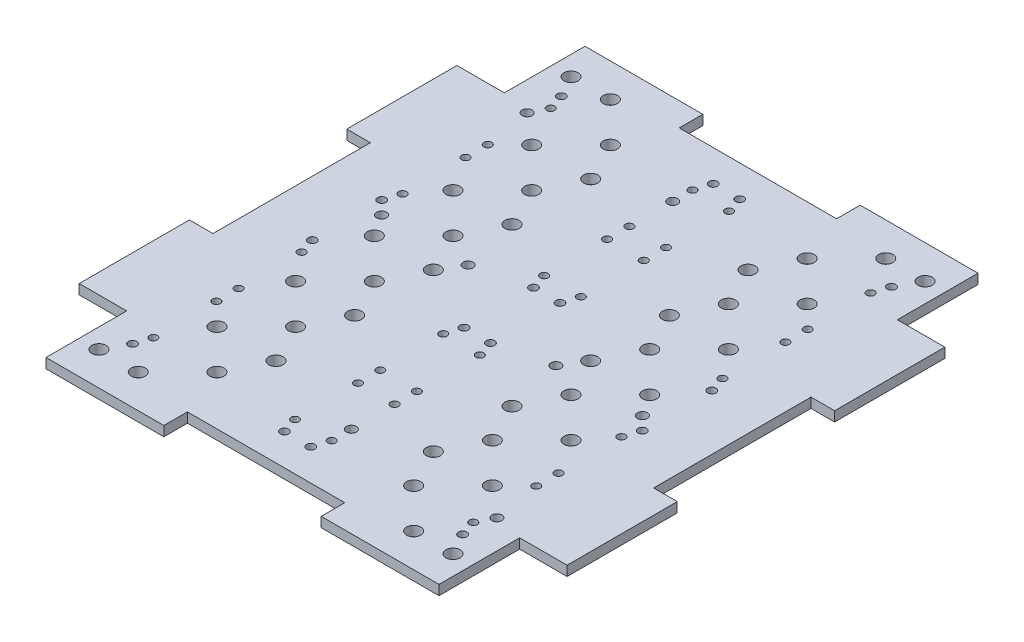
from build123d import *

# Parameters (mm, degrees)
SKETCH1_R                 = 2.286
BOSS_EXTRUDE1_DEPTH       = 3.175
SKETCH2_R                 = 1.35
RASPBERRY_PI_HOLES_DEPTH  = 118.380570155
SKETCH3_R                 = 1.27
FEATHER_BOARD_HOLES_DEPTH = 118.380570155
SKETCH4_R                 = 1.6
ARDUINO_UNO_1_DEPTH       = 118.380570155
SKETCH5_R                 = 1.6
ARDUINO_UNO_2_DEPTH       = 118.380570155
SKETCH6_R                 = 2.286
CUSTOM_PCB_3_INCH_DEPTH   = 118.380570155
SKETCH7_R                 = 2.286
CUSTOM_PCB_2_5_INCH_DEPTH = 118.380570155
SKETCH8_R                 = 2.286
CUSTOM_PCB_2_INCH_DEPTH   = 118.380570155


with BuildPart() as part:
    # Sketch1 → Boss-Extrude1 (new body)
    with BuildSketch(Plane(origin=(0, 0, 0), x_dir=(1, 0, 0), z_dir=(0, 1, 0))):
        Polygon((-25.4, 86.995), (-63.43142, 86.995), (-63.43142, 60.96), (-78.74, 60.96), (-78.74, 25.4), (-71.12, 25.4), (-71.12, -25.4), (-78.74, -25.4), (-78.74, -60.96), (-63.43142, -60.96), (-63.43142, -86.995), (-25.4, -86.995), (-25.4, -79.375), (25.4, -79.375), (25.4, -86.995), (63.43142, -86.995), (63.43142, -60.96), (78.74, -60.96), (78.74, -25.4), (71.12, -25.4), (71.12, 25.4), (78.74, 25.4), (78.74, 60.96), (63.43142, 60.96), (63.43142, 86.995), (25.4, 86.995), (25.4, 79.375), (-25.4, 79.375), align=None)
        with Locations((-57.15, 76.2)):
            Circle(SKETCH1_R, mode=Mode.SUBTRACT)
        with Locations((57.15, 76.2)):
            Circle(SKETCH1_R, mode=Mode.SUBTRACT)
        with Locations((57.15, -76.2)):
            Circle(SKETCH1_R, mode=Mode.SUBTRACT)
        with Locations((-57.15, -76.2)):
            Circle(SKETCH1_R, mode=Mode.SUBTRACT)
    extrude(amount=BOSS_EXTRUDE1_DEPTH)

    # Sketch2 → Raspberry Pi Holes (cut, through all)
    with BuildSketch(Plane(origin=(0, 3.175, 0), x_dir=(1, 0, 0), z_dir=(0, 1, 0))):
        with Locations((-53.27142, -69.215)):
            Circle(SKETCH2_R)
        with Locations((-4.27142, -69.215)):
            Circle(SKETCH2_R)
        with Locations((-4.27142, -11.215)):
            Circle(SKETCH2_R)
        with Locations((-53.27142, -11.215)):
            Circle(SKETCH2_R)
        with Locations((53.27142, -11.215)):
            Circle(SKETCH2_R)
        with Locations((4.27142, -11.215)):
            Circle(SKETCH2_R)
        with Locations((4.27142, -69.215)):
            Circle(SKETCH2_R)
        with Locations((53.27142, -69.215)):
            Circle(SKETCH2_R)
        with Locations((53.27142, 11.215)):
            Circle(SKETCH2_R)
        with Locations((53.27142, 69.215)):
            Circle(SKETCH2_R)
        with Locations((4.27142, 69.215)):
            Circle(SKETCH2_R)
        with Locations((4.27142, 11.215)):
            Circle(SKETCH2_R)
        with Locations((-4.27142, 11.215)):
            Circle(SKETCH2_R)
        with Locations((-4.27142, 69.215)):
            Circle(SKETCH2_R)
        with Locations((-53.27142, 11.215)):
            Circle(SKETCH2_R)
        with Locations((-53.27142, 69.215)):
            Circle(SKETCH2_R)
    extrude(amount=-RASPBERRY_PI_HOLES_DEPTH, mode=Mode.SUBTRACT)

    # Sketch3 → Feather Board Holes (cut, through all)
    with BuildSketch(Plane(origin=(0, 3.175, 0), x_dir=(1, 0, 0), z_dir=(0, 1, 0))):
        with Locations((-51.63142, -64.135)):
            Circle(SKETCH3_R)
        with Locations((-5.91142, -64.135)):
            Circle(SKETCH3_R)
        with Locations((-5.91142, -43.815)):
            Circle(SKETCH3_R)
        with Locations((-51.63142, -43.815)):
            Circle(SKETCH3_R)
        with Locations((-51.63142, -16.295)):
            Circle(SKETCH3_R)
        with Locations((-51.63142, -36.615)):
            Circle(SKETCH3_R)
        with Locations((-5.91142, -36.615)):
            Circle(SKETCH3_R)
        with Locations((-5.91142, -16.295)):
            Circle(SKETCH3_R)
        with Locations((5.91142, -16.295)):
            Circle(SKETCH3_R)
        with Locations((5.91142, -36.615)):
            Circle(SKETCH3_R)
        with Locations((51.63142, -36.615)):
            Circle(SKETCH3_R)
        with Locations((51.63142, -16.295)):
            Circle(SKETCH3_R)
        with Locations((51.63142, -43.815)):
            Circle(SKETCH3_R)
        with Locations((5.91142, -43.815)):
            Circle(SKETCH3_R)
        with Locations((5.91142, -64.135)):
            Circle(SKETCH3_R)
        with Locations((51.63142, -64.135)):
            Circle(SKETCH3_R)
        with Locations((51.63142, 64.135)):
            Circle(SKETCH3_R)
        with Locations((5.91142, 64.135)):
            Circle(SKETCH3_R)
        with Locations((5.91142, 43.815)):
            Circle(SKETCH3_R)
        with Locations((51.63142, 43.815)):
            Circle(SKETCH3_R)
        with Locations((51.63142, 16.295)):
            Circle(SKETCH3_R)
        with Locations((51.63142, 36.615)):
            Circle(SKETCH3_R)
        with Locations((5.91142, 36.615)):
            Circle(SKETCH3_R)
        with Locations((5.91142, 16.295)):
            Circle(SKETCH3_R)
        with Locations((-5.91142, 16.295)):
            Circle(SKETCH3_R)
        with Locations((-5.91142, 36.615)):
            Circle(SKETCH3_R)
        with Locations((-51.63142, 36.615)):
            Circle(SKETCH3_R)
        with Locations((-51.63142, 16.295)):
            Circle(SKETCH3_R)
        with Locations((-51.63142, 43.815)):
            Circle(SKETCH3_R)
        with Locations((-5.91142, 43.815)):
            Circle(SKETCH3_R)
        with Locations((-5.91142, 64.135)):
            Circle(SKETCH3_R)
        with Locations((-51.63142, 64.135)):
            Circle(SKETCH3_R)
    extrude(amount=-FEATHER_BOARD_HOLES_DEPTH, mode=Mode.SUBTRACT)

    # Sketch4 → Arduino Uno 1 (cut, through all)
    with BuildSketch(Plane(origin=(0, 3.175, 0), x_dir=(1, 0, 0), z_dir=(0, 1, 0))):
        with Locations((5.91142, -57.785)):
            Circle(SKETCH4_R)
        with Locations((21.15142, -6.985)):
            Circle(SKETCH4_R)
        with Locations((49.09142, -6.985)):
            Circle(SKETCH4_R)
        with Locations((54.17142, -59.055)):
            Circle(SKETCH4_R)
    extrude(amount=-ARDUINO_UNO_1_DEPTH, mode=Mode.SUBTRACT)

    # Sketch5 → Arduino Uno 2 (cut, through all)
    with BuildSketch(Plane(origin=(0, 3.175, 0), x_dir=(1, 0, 0), z_dir=(0, 1, 0))):
        with Locations((-5.91142, 57.785)):
            Circle(SKETCH5_R)
        with Locations((-54.17142, 59.055)):
            Circle(SKETCH5_R)
        with Locations((-49.09142, 6.985)):
            Circle(SKETCH5_R)
        with Locations((-21.15142, 6.985)):
            Circle(SKETCH5_R)
    extrude(amount=-ARDUINO_UNO_2_DEPTH, mode=Mode.SUBTRACT)

    # Sketch6 → Custom PCB 3 inch (cut, through all)
    with BuildSketch(Plane(origin=(0, 3.175, 0), x_dir=(1, 0, 0), z_dir=(0, 1, 0))):
        with Locations((44.45, 76.2)):
            Circle(SKETCH6_R)
        with Locations((-44.45, 76.2)):
            Circle(SKETCH6_R)
        with Locations((44.45, 50.8)):
            Circle(SKETCH6_R)
        with Locations((-44.45, 50.8)):
            Circle(SKETCH6_R)
        with Locations((44.45, 25.4)):
            Circle(SKETCH6_R)
        with Locations((-44.45, 25.4)):
            Circle(SKETCH6_R)
        with Locations((44.45, 0)):
            Circle(SKETCH6_R)
        with Locations((-44.45, 0)):
            Circle(SKETCH6_R)
        with Locations((44.45, -25.4)):
            Circle(SKETCH6_R)
        with Locations((-44.45, -25.4)):
            Circle(SKETCH6_R)
        with Locations((44.45, -50.8)):
            Circle(SKETCH6_R)
        with Locations((-44.45, -50.8)):
            Circle(SKETCH6_R)
        with Locations((44.45, -76.2)):
            Circle(SKETCH6_R)
        with Locations((-44.45, -76.2)):
            Circle(SKETCH6_R)
    extrude(amount=-CUSTOM_PCB_3_INCH_DEPTH, mode=Mode.SUBTRACT)

    # Sketch7 → Custom PCB 2.5 inch (cut, through all)
    with BuildSketch(Plane(origin=(0, 3.175, 0), x_dir=(1, 0, 0), z_dir=(0, 1, 0))):
        with Locations((-31.75, -63.5)):
            Circle(SKETCH7_R)
        with Locations((31.75, -63.5)):
            Circle(SKETCH7_R)
        with Locations((31.75, -38.1)):
            Circle(SKETCH7_R)
        with Locations((-31.75, -38.1)):
            Circle(SKETCH7_R)
        with Locations((31.75, -12.7)):
            Circle(SKETCH7_R)
        with Locations((-31.75, -12.7)):
            Circle(SKETCH7_R)
        with Locations((31.75, 12.7)):
            Circle(SKETCH7_R)
        with Locations((-31.75, 12.7)):
            Circle(SKETCH7_R)
        with Locations((31.75, 38.1)):
            Circle(SKETCH7_R)
        with Locations((-31.75, 38.1)):
            Circle(SKETCH7_R)
        with Locations((31.75, 63.5)):
            Circle(SKETCH7_R)
        with Locations((-31.75, 63.5)):
            Circle(SKETCH7_R)
    extrude(amount=-CUSTOM_PCB_2_5_INCH_DEPTH, mode=Mode.SUBTRACT)

    # Sketch8 → Custom PCB 2 inch (cut, through all)
    with BuildSketch(Plane(origin=(0, 3.175, 0), x_dir=(1, 0, 0), z_dir=(0, 1, 0))):
        with Locations((-25.4, -50.8)):
            Circle(SKETCH8_R)
        with Locations((25.4, -50.8)):
            Circle(SKETCH8_R)
        with Locations((-25.4, -25.4)):
            Circle(SKETCH8_R)
        with Locations((25.4, -25.4)):
            Circle(SKETCH8_R)
        with Locations((-25.4, 0)):
            Circle(SKETCH8_R)
        with Locations((25.4, 0)):
            Circle(SKETCH8_R)
        with Locations((-25.4, 25.4)):
            Circle(SKETCH8_R)
        with Locations((25.4, 25.4)):
            Circle(SKETCH8_R)
        with Locations((-25.4, 50.8)):
            Circle(SKETCH8_R)
        with Locations((25.4, 50.8)):
            Circle(SKETCH8_R)
    extrude(amount=-CUSTOM_PCB_2_INCH_DEPTH, mode=Mode.SUBTRACT)


solid = part.part
